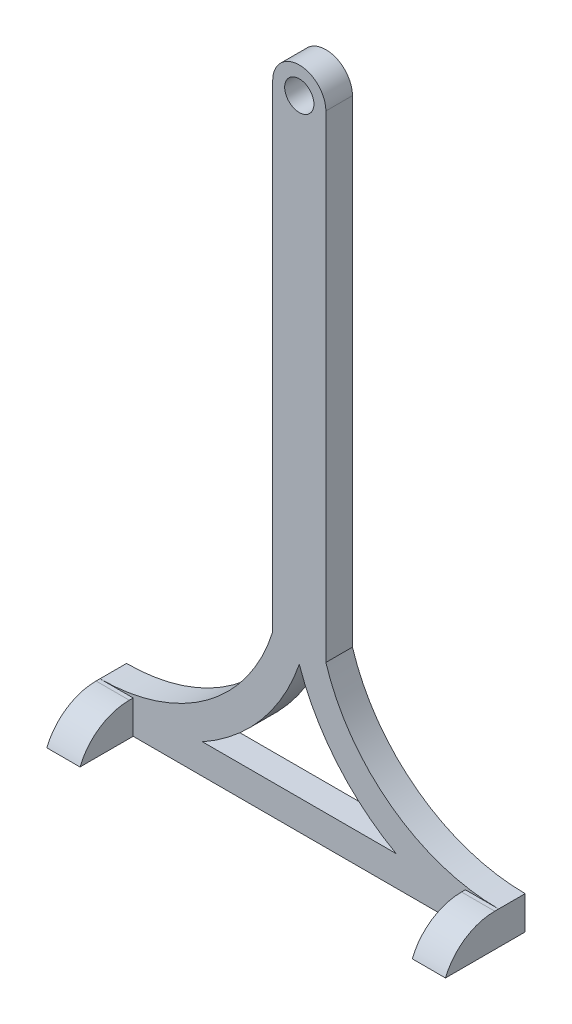
from build123d import *

# Parameters (mm, degrees)
SKETCH1_R           = 2.2
BOSS_EXTRUDE1_DEPTH = 4
SKETCH2_W           = 5
SKETCH2_H           = 5
BOSS_EXTRUDE2_DEPTH = 8
FILLET1_R           = 8


with BuildPart() as part:
    # Sketch1 → Boss-Extrude1 (new body)
    with BuildSketch(Plane.XY):
        with BuildLine():
            Line((-30, 0), (30, 0))
            Line((30, 0), (30, 5))
            ThreePointArc((30, 5), (13.861944355, 10.296039854), (4, 24.124522477))
            Line((4, 24.124522477), (4, 96))
            ThreePointArc((4, 96), (0, 100), (-4, 96))
            Line((-4, 96), (-4, 24.124522477))
            ThreePointArc((-4, 24.124522477), (-13.861944355, 10.296039854), (-30, 5))
            Line((-30, 5), (-30, 0))
        make_face()
        with Locations((0, 96)):
            Circle(SKETCH1_R, mode=Mode.SUBTRACT)
        with BuildLine():
            Line((-14.576406349, 4.5), (14.576406349, 4.5))
            ThreePointArc((14.576406349, 4.5), (5.681813978, 11.844889874), (0, 21.883723005))
            ThreePointArc((0, 21.883723005), (-5.681813978, 11.844889874), (-14.576406349, 4.5))
        make_face(mode=Mode.SUBTRACT)
    extrude(amount=BOSS_EXTRUDE1_DEPTH)

    # Sketch2 → Boss-Extrude2 (add)
    with BuildSketch(Plane.XY.offset(4)):
        with Locations((27.5, 2.5)):
            Rectangle(SKETCH2_W, SKETCH2_H)
        with Locations((-27.5, 2.5)):
            Rectangle(SKETCH2_W, SKETCH2_H)
    extrude(amount=BOSS_EXTRUDE2_DEPTH)

    # Fillet1
    # the kernel refuses this fillet: 8 mm, written as the material it takes off along each edge
    with BuildSketch(Plane(origin=(6.459503782, 5, 12), x_dir=(0, -1, 0), z_dir=(1, 0, 0))) as fillet1_piece_1:
        with BuildLine():
            CenterArc((8, 7.416198487), FILLET1_R, 180, 67.975687163)
            Line((0, 7.416198487), (-0.16, 7.416198487))
            Line((-0.16, 7.416198487), (-0.16, 0))
            Line((-0.16, 0), (0, -0.16))
            ThreePointArc((0, -0.16), (2.5, -0.16), (4.94, -0.14832397))
            Line((4.94, -0.14832397), (5, 0))
        make_face()
    extrude(amount=42.080992435, mode=Mode.SUBTRACT)
    with BuildSketch(Plane(origin=(-6.459503782, 5, 12), x_dir=(0, 0, -1), z_dir=(-1, 0, 0))) as fillet1_piece_2:
        with BuildLine():
            CenterArc((7.416198487, 8), FILLET1_R, 202.024312837, 67.975687163)
            Line((0, 5), (-0.14832397, 4.94))
            ThreePointArc((-0.14832397, 4.94), (-0.16, 2.5), (-0.16, 0))
            Line((-0.16, 0), (0, -0.16))
            Line((0, -0.16), (7.416198487, -0.16))
            Line((7.416198487, -0.16), (7.416198487, 0))
        make_face()
    extrude(amount=42.080992435, mode=Mode.SUBTRACT)


solid = part.part
